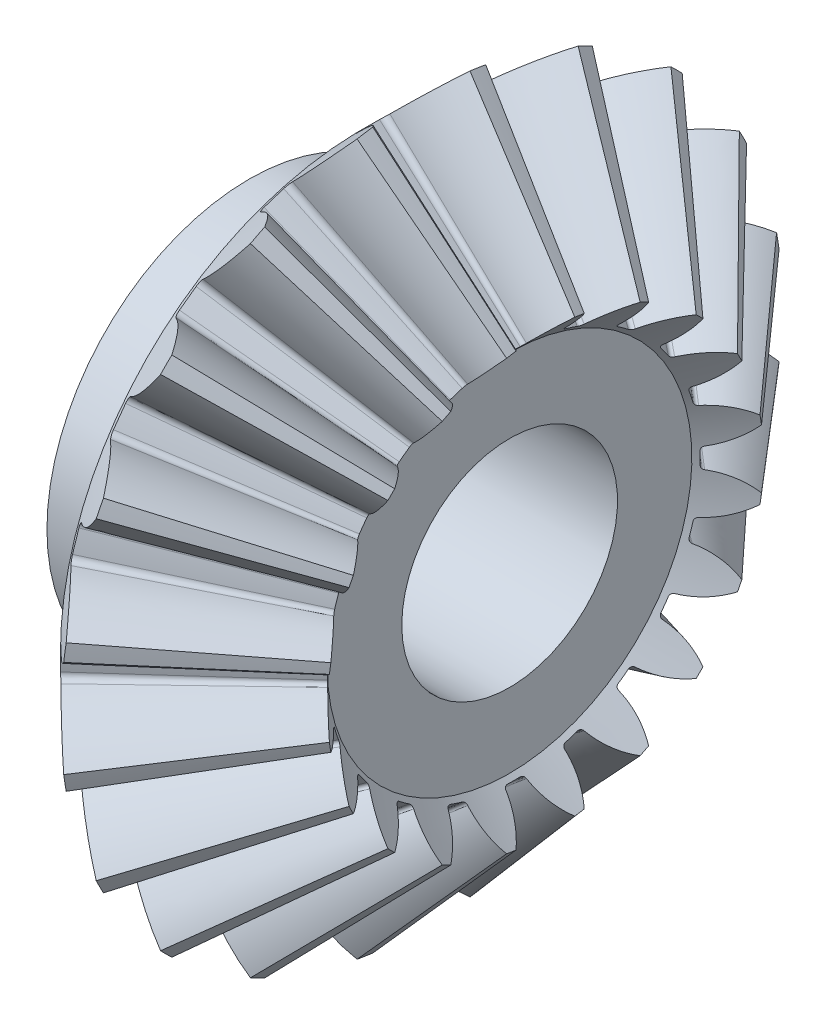
from build123d import *

# Parameters (mm, degrees)
TEETHCUTS_COUNT = 20
TEETHCUTS_ANGLE = 342
HUBSKE_R        = 7.5
HUB_DEPTH       = 4.186650754
BORSKE_R        = 4
BORE_DEPTH      = 18.0000508


with BuildPart() as part:
    # BasProSke → Base-Revolve (revolve)
    with BuildSketch(Plane(origin=(0, 0, 0), x_dir=(1, 0, 0), z_dir=(0, 1, 0)), mode=Mode.PRIVATE) as base_revolve_sk:
        Polygon((0, 0), (0, 11.186549155), (2.197334325, 13.383883476), (6.797081788, 8.084136003), (5.469847465, 6.756901682), (5.469847465, 0), align=None)
    revolve(base_revolve_sk.sketch.rotate(Axis((-10, 0, 0), (1, 0, 0)), 180), axis=Axis((-10, 0, 0), (1, 0, 0)))

    # ToothCut: read off the stored shape, not the designer's step
    # ToothCut: loft between two sections, ruled curve by curve
    toothcut_from = [
        Edge.make_bspline([(13.819493714, 0.006042867, -0.009394533), (13.815270661, 0.001819813, -0.014827352), (13.809590081, -0.003860766, -0.01402366), (13.806211744, -0.007239103, -0.007515391)], [0, 0, 0, 0, 1, 1, 1, 1], 3, [1, 0.779378825, 0.779378825, 1]),
        Edge.make_bspline([(13.806211744, -0.007239103, 0.007515391), (13.809590081, -0.003860766, 0.01402366), (13.815270661, 0.001819813, 0.014827352), (13.819493714, 0.006042867, 0.009394533)], [0, 0, 0, 0, 1, 1, 1, 1], 3, [1, 0.779378825, 0.779378825, 1]),
        Edge.make_bspline([(13.806211744, -0.007239103, -0.007515391), (13.805710677, -0.00774017, -0.0065501), (13.805310479, -0.008140368, -0.005494824), (13.805019088, -0.008431759, -0.004370499)], [0, 0, 0, 0, 1, 1, 1, 1], 3, [1, 0.99338734, 0.99338734, 1]),
        Edge.make_bspline([(13.805019088, -0.008431759, 0.004370499), (13.805310479, -0.008140368, 0.005494824), (13.805710677, -0.00774017, 0.0065501), (13.806211744, -0.007239103, 0.007515391)], [0, 0, 0, 0, 1, 1, 1, 1], 3, [1, 0.99338734, 0.99338734, 1]),
        Edge.make_bspline([(13.805019088, -0.008431759, -0.004370499), (13.804279983, -0.009170865, -0.001518673), (13.804279983, -0.009170865, 0.001518673), (13.805019088, -0.008431759, 0.004370499)], [0, 0, 0, 0, 1, 1, 1, 1], 3, [1, 0.959280408, 0.959280408, 1]),
        Edge.make_line((13.819493714, 0.006042867, 0.009394533), (13.819493714, 0.006042867, -0.009394533)),
    ]
    toothcut_to = [
        Edge.make_bspline([(2.289545295, 13.476094446, -2.008719527), (1.770094319, 12.956643471, -1.276936363), (1.11883097, 12.305380123, -0.800619942), (0.396336001, 11.582885155, -0.624077393)], [0, 0, 0, 0, 1, 1, 1, 1], 3, [1, 0.968993212, 0.968993212, 1]),
        Edge.make_bspline([(0.396336001, 11.582885155, 0.624077393), (1.11883097, 12.305380123, 0.800619942), (1.770094319, 12.956643471, 1.276936363), (2.289545295, 13.476094446, 2.008719527)], [0, 0, 0, 0, 1, 1, 1, 1], 3, [1, 0.968993212, 0.968993212, 1]),
        Edge.make_bspline([(0.396336001, 11.582885155, -0.624077393), (0.310113141, 11.496662295, -0.603008729), (0.254927152, 11.441476307, -0.506979228), (0.257972348, 11.444521502, -0.383309888)], [0, 0, 0, 0, 1, 1, 1, 1], 3, [1, 0.835741447, 0.835741447, 1]),
        Edge.make_bspline([(0.257972348, 11.444521502, 0.383309888), (0.254927152, 11.441476307, 0.506979228), (0.310113141, 11.496662295, 0.603008729), (0.396336001, 11.582885155, 0.624077393)], [0, 0, 0, 0, 1, 1, 1, 1], 3, [1, 0.835741447, 0.835741447, 1]),
        Edge.make_bspline([(0.257972348, 11.444521502, -0.383309888), (0.264263412, 11.450812567, -0.127821584), (0.264263412, 11.450812567, 0.127821584), (0.257972348, 11.444521502, 0.383309888)], [0, 0, 0, 0, 1, 1, 1, 1], 3, [1, 0.99959615, 0.99959615, 1]),
        Edge.make_line((2.289545295, 13.476094446, 2.008719527), (2.289545295, 13.476094446, -2.008719527)),
    ]
    toothcut = Solid(Shell([*[Face.make_surface_from_curves(toothcut_from[k], toothcut_to[k]) for k in range(6)], Face(Wire(toothcut_from)), Face(Wire(toothcut_to))]))
    add(toothcut, mode=Mode.SUBTRACT)

    # TeethCuts: ToothCut ×20 about axis
    teethcuts_axis = Axis((-10, 0, 0), (1, 0, 0))
    for i in range(1, TEETHCUTS_COUNT):
        add(toothcut.rotate(teethcuts_axis, i * TEETHCUTS_ANGLE / (TEETHCUTS_COUNT - 1)), mode=Mode.SUBTRACT)

    # HubSke → Hub (add)
    with BuildSketch(Plane.ZY):
        with Locations(Location((0, 0, 0), (0, 0, 180))):
            Circle(HUBSKE_R)
    extrude(amount=HUB_DEPTH)

    # BorSke → Bore (cut, symmetric)
    with BuildSketch(Plane(origin=(0, 0, 0), x_dir=(0, 0, -1), z_dir=(1, 0, 0))):
        with Locations(Location((0, 0, 0), (0, 0, 180))):
            Circle(BORSKE_R)
    extrude(amount=BORE_DEPTH, both=True, mode=Mode.SUBTRACT)


solid = part.part
